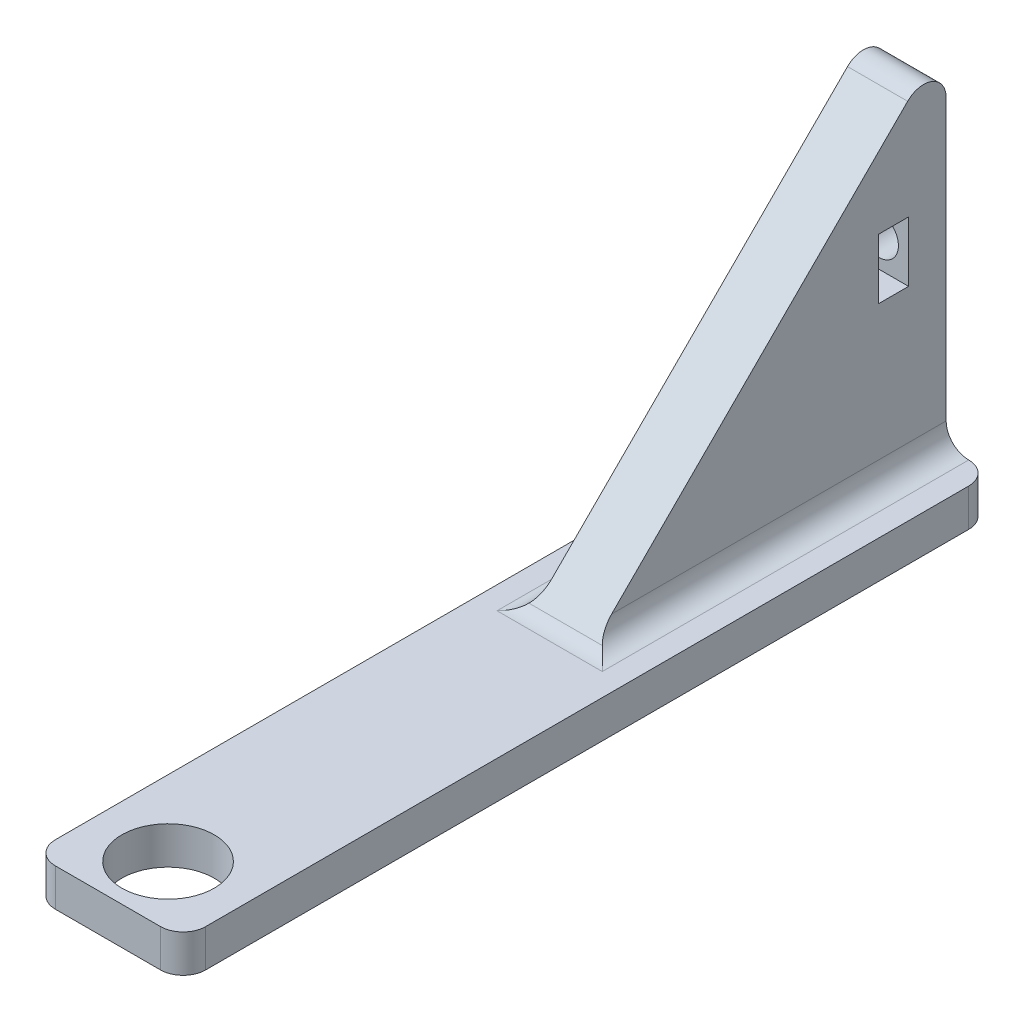
from build123d import *

# Parameters (mm, degrees)
SKETCH3_W                = 20
SKETCH3_H                = 107.5
SKETCH3_R                = 6.15
BOSS_EXTRUDE2_DEPTH      = 5
BOSS_EXTRUDE3_DEPTH      = 4
BOSS_EXTRUDE3_DEPTH_BACK = 4
SKETCH5_R                = 2.65
CUT_EXTRUDE1_DEPTH       = 12
SKETCH6_W                = 4
SKETCH6_H                = 8
CUT_EXTRUDE2_DEPTH       = 121.451234946
FILLET1_R                = 3


with BuildPart() as part:
    # Sketch3 → Boss-Extrude2 (new body)
    with BuildSketch(Plane(origin=(0, 0, 0), x_dir=(1, 0, 0), z_dir=(0, 1, 0))):
        with Locations((10, -53.75)):
            Rectangle(SKETCH3_W, SKETCH3_H)
        with Locations(Location((10, -99.5, 0), (0, 0, 270))):
            Circle(SKETCH3_R, mode=Mode.SUBTRACT)
    extrude(amount=BOSS_EXTRUDE2_DEPTH)

    # Sketch4 → Boss-Extrude3 (add, two sides: drawn at the far end of the back side and taken through both)
    with BuildSketch(Plane(origin=(10, 0, 0), x_dir=(0, 0, -1), z_dir=(1, 0, 0)).offset(-BOSS_EXTRUDE3_DEPTH_BACK)):
        Polygon((0, 5), (0, 52.5), (-47.5, 5), align=None)
    extrude(amount=BOSS_EXTRUDE3_DEPTH + BOSS_EXTRUDE3_DEPTH_BACK)

    # Sketch5 → Cut-Extrude1 (cut)
    with BuildSketch(Plane(origin=(0, 0, 0), x_dir=(-1, 0, 0), z_dir=(0, 0, -1))):
        with Locations((-10, 30)):
            Circle(SKETCH5_R)
    extrude(amount=-CUT_EXTRUDE1_DEPTH, mode=Mode.SUBTRACT)

    # Sketch6 → Cut-Extrude2 (cut, through all)
    with BuildSketch(Plane(origin=(14, 0, 0), x_dir=(0, 0, -1), z_dir=(1, 0, 0))):
        with Locations((-7, 30)):
            Rectangle(SKETCH6_W, SKETCH6_H)
    extrude(amount=-CUT_EXTRUDE2_DEPTH, mode=Mode.SUBTRACT)

    # Fillet1
    fillet1_edges = [part.edges().sort_by_distance(p)[0] for p in [
        (20, 2.5, 107.5),
        (0, 2.5, 107.5),
        (6, 5, 23.75),
        (10, 5, 47.5),
        (14, 5, 23.75),
        (10, 52.5, 0),
        (20, 2.5, 0),
        (0, 2.5, 0),
    ]]
    fillet(fillet1_edges, radius=FILLET1_R - 0.0001)  # a hair under: the kernel refuses the full size


solid = part.part
